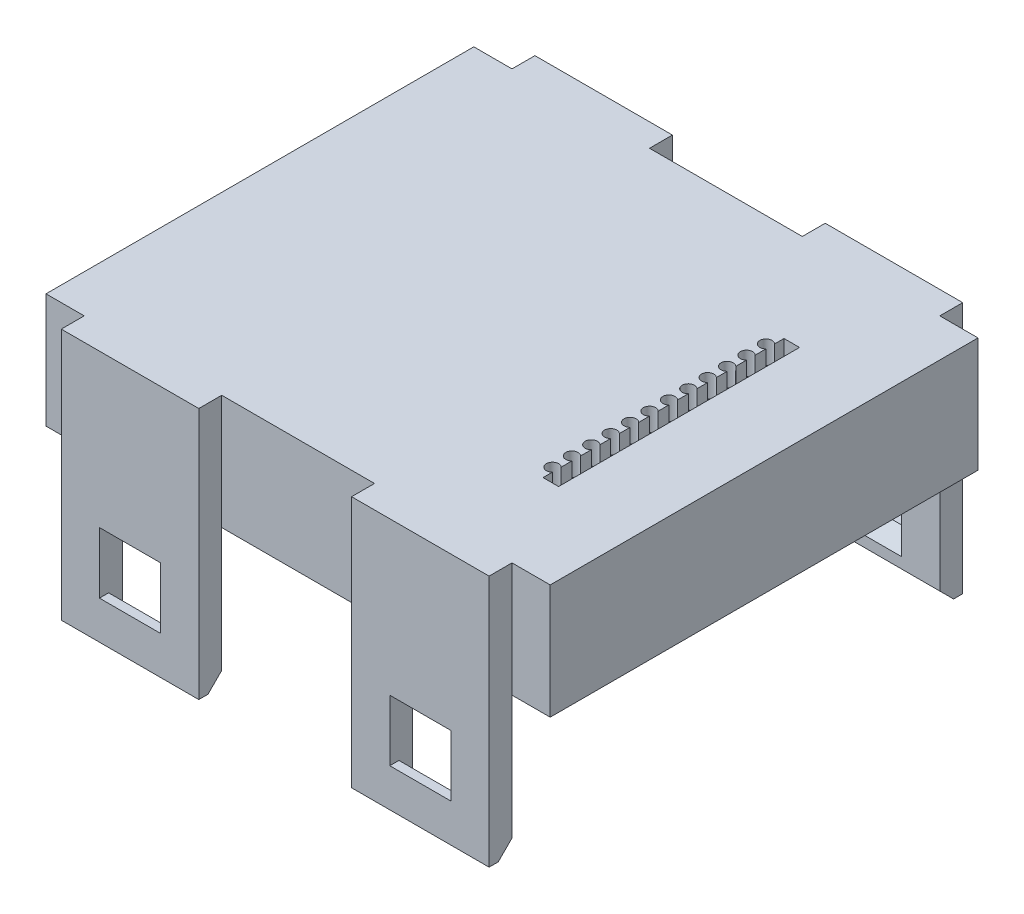
from build123d import *

# Parameters (mm, degrees)
SKETCH1_W           = 66
SKETCH1_H           = 56
BASE_DEPTH          = 3
WALL1_START         = -3
SKETCH4_W           = 66
SKETCH4_H           = 56
SKETCH4_W_2         = 58
SKETCH4_H_2         = 48
WALL1_DEPTH         = 12
WALL2_START         = -15
SKETCH8_W           = 62
SKETCH8_H           = 52
SKETCH8_W_2         = 58
SKETCH8_H_2         = 48
WALL2_DEPTH         = 2
BATTERYWALL_START   = -3
BATTERYWALL_DEPTH   = 8
BATTERYHOLDER_START = -11
SKETCH10_W          = 20
SKETCH10_H          = 48
BATTERYHOLDER_DEPTH = 2
BATTERYNOTCH_START  = -3
SKETCH15_W          = 1
SKETCH15_H          = 5
BATTERYNOTCH_DEPTH  = 1.2
BATTERYNOTCH2_R     = 1
CLIPS1_START        = 28
SKETCH11_W          = 18
SKETCH11_H          = 33
SKETCH11_W_2        = 8
SKETCH11_H_2        = 8
CLIPS1_DEPTH        = 3
CLIPS2_START        = -28
SKETCH11_2_W        = 18
SKETCH11_2_H        = 33
SKETCH11_2_W_2      = 8
SKETCH11_2_H_2      = 8
CLIPS2_DEPTH        = 3
CHAMFER3_SIZE       = 1.8
WIRESLOTS_START     = -3
SKETCH12_R          = 0.8
WIRESLOTS_DEPTH     = 60.026779311
WIRESLOTS2_START    = -3
SKETCH13_W          = 2.034314575
SKETCH13_H          = 31.54
WIRESLOTS2_DEPTH    = 60.026779311


with BuildPart() as part:
    # Sketch1 → Base (new body)
    with BuildSketch(Plane(origin=(0, 0, 0), x_dir=(1, 0, 0), z_dir=(0, 1, 0))):
        Rectangle(SKETCH1_W, SKETCH1_H)
    extrude(amount=-BASE_DEPTH)

    # Sketch4 → Wall1 (add)
    with BuildSketch(Plane(origin=(0, 0, 0), x_dir=(1, 0, 0), z_dir=(0, 1, 0)).offset(WALL1_START)):
        Rectangle(SKETCH4_W, SKETCH4_H)
        Rectangle(SKETCH4_W_2, SKETCH4_H_2, mode=Mode.SUBTRACT)
    extrude(amount=-WALL1_DEPTH)

    # Sketch8 → Wall2 (add)
    with BuildSketch(Plane(origin=(0, 0, 0), x_dir=(1, 0, 0), z_dir=(0, 1, 0)).offset(WALL2_START)):
        Rectangle(SKETCH8_W, SKETCH8_H)
        Rectangle(SKETCH8_W_2, SKETCH8_H_2, mode=Mode.SUBTRACT)
    extrude(amount=-WALL2_DEPTH)

    # Sketch9 → BatteryWall (add)
    with BuildSketch(Plane(origin=(0, 0, 0), x_dir=(1, 0, 0), z_dir=(0, 1, 0)).offset(BATTERYWALL_START)):
        Polygon((-23, 8.5), (13, 8.5), (13, 10.5), (-25, 10.5), (-25, -10.5), (13, -10.5), (13, -8.5), (-23, -8.5), align=None)
    extrude(amount=-BATTERYWALL_DEPTH)

    # Sketch10 → BatteryHolder (add)
    with BuildSketch(Plane(origin=(0, 0, 0), x_dir=(1, 0, 0), z_dir=(0, 1, 0)).offset(BATTERYHOLDER_START)):
        Rectangle(SKETCH10_W, SKETCH10_H)
    extrude(amount=-BATTERYHOLDER_DEPTH)

    # Sketch15 → BatteryNotch (add)
    with BuildSketch(Plane(origin=(0, 0, 0), x_dir=(1, 0, 0), z_dir=(0, 1, 0)).offset(BATTERYNOTCH_START)):
        with Locations((13.5, 0.010715453)):
            Rectangle(SKETCH15_W, SKETCH15_H)
    extrude(amount=-BATTERYNOTCH_DEPTH)

    # BatteryNotch2
    # the kernel refuses this fillet: 1 mm, written as the material it takes off along each edge
    with BuildSketch(Plane(origin=(14, -4.2, 4.989284547), x_dir=(0, 1, 0), z_dir=(0, 0, -1)), Plane(origin=(13, -4.2, -5.010715453), x_dir=(0, 1, 0), z_dir=(0, 0, 1))) as batterynotch2_piece_1:
        with BuildLine():
            CenterArc((BATTERYNOTCH2_R, -BATTERYNOTCH2_R), BATTERYNOTCH2_R, 90, 90)
            Line((0, -BATTERYNOTCH2_R), (0, 0))
            Line((0, 0), (BATTERYNOTCH2_R, 0))
        make_face()
    extrude(amount=10, mode=Mode.SUBTRACT)
    with BuildSketch(Plane(origin=(10.5, -4.2, 2.489284547), x_dir=(0, 1, 0), z_dir=(1, 0, 0)), Plane(origin=(16.5, -4.2, -2.510715453), x_dir=(0, 1, 0), z_dir=(-1, 0, 0))) as batterynotch2_piece_2:
        with BuildLine():
            CenterArc((BATTERYNOTCH2_R, -BATTERYNOTCH2_R), BATTERYNOTCH2_R, 90, 90)
            Line((0, -BATTERYNOTCH2_R), (0, 0))
            Line((0, 0), (BATTERYNOTCH2_R, 0))
        make_face()
    extrude(amount=6, mode=Mode.SUBTRACT)

    # Sketch11 → Clips1 (add)
    # profile 1 of 2: a face of its own
    with BuildSketch(Plane.XY.offset(CLIPS1_START)):
        with Locations((-19, -16.5)):
            Rectangle(SKETCH11_W, SKETCH11_H)
        with Locations((-19, -24)):
            Rectangle(SKETCH11_W_2, SKETCH11_H_2, mode=Mode.SUBTRACT)
    # profile 2 of 2: a face of its own
    with BuildSketch(Plane.XY.offset(CLIPS1_START)):
        with Locations((19, -16.5)):
            Rectangle(SKETCH11_W, SKETCH11_H)
        with Locations((19, -24)):
            Rectangle(SKETCH11_W_2, SKETCH11_H_2, mode=Mode.SUBTRACT)
    extrude(amount=CLIPS1_DEPTH)

    # Sketch11<2> → Clips2 (add)
    # profile 1 of 2: a face of its own
    with BuildSketch(Plane.XY.offset(CLIPS2_START)):
        with Locations((-19, -16.5)):
            Rectangle(SKETCH11_2_W, SKETCH11_2_H)
        with Locations((-19, -24)):
            Rectangle(SKETCH11_2_W_2, SKETCH11_2_H_2, mode=Mode.SUBTRACT)
    # profile 2 of 2: a face of its own
    with BuildSketch(Plane.XY.offset(CLIPS2_START)):
        with Locations((19, -16.5)):
            Rectangle(SKETCH11_2_W, SKETCH11_2_H)
        with Locations((19, -24)):
            Rectangle(SKETCH11_2_W_2, SKETCH11_2_H_2, mode=Mode.SUBTRACT)
    extrude(amount=-CLIPS2_DEPTH)

    # Chamfer3
    chamfer3_edges = [part.edges().sort_by_distance(p)[0] for p in [
        (-19, -33, 28),
        (-19, -28, 28),
        (19, -33, 28),
        (19, -28, 28),
        (-19, -28, -28),
        (-19, -33, -28),
        (19, -28, -28),
        (19, -33, -28),
    ]]
    chamfer(chamfer3_edges, length=CHAMFER3_SIZE)

    # Sketch12 → WireSlots (cut, through all)
    with BuildSketch(Plane(origin=(0, 0, 0), x_dir=(1, 0, 0), z_dir=(0, 1, 0)).offset(WIRESLOTS_START)):
        with Locations(Location((19.8, -14.5, 0), (0, 0, 90))):
            Circle(SKETCH12_R)
        with Locations(Location((19.8, -11.96, 0), (0, 0, 90))):
            Circle(SKETCH12_R)
        with Locations(Location((19.8, -9.42, 0), (0, 0, 90))):
            Circle(SKETCH12_R)
        with Locations(Location((19.8, -6.88, 0), (0, 0, 90))):
            Circle(SKETCH12_R)
        with Locations(Location((19.8, -4.34, 0), (0, 0, 90))):
            Circle(SKETCH12_R)
        with Locations(Location((19.8, -1.8, 0), (0, 0, 90))):
            Circle(SKETCH12_R)
        with Locations(Location((19.8, 0.74, 0), (0, 0, 90))):
            Circle(SKETCH12_R)
        with Locations(Location((19.8, 3.28, 0), (0, 0, 90))):
            Circle(SKETCH12_R)
        with Locations(Location((19.8, 5.82, 0), (0, 0, 90))):
            Circle(SKETCH12_R)
        with Locations(Location((19.8, 8.36, 0), (0, 0, 90))):
            Circle(SKETCH12_R)
        with Locations(Location((19.8, 10.9, 0), (0, 0, 90))):
            Circle(SKETCH12_R)
        with Locations(Location((19.8, 13.44, 0), (0, 0, 90))):
            Circle(SKETCH12_R)
    extrude(amount=WIRESLOTS_DEPTH, mode=Mode.SUBTRACT)

    # Sketch13 → WireSlots2 (cut, through all)
    with BuildSketch(Plane(origin=(0, 0, 0), x_dir=(1, 0, 0), z_dir=(0, 1, 0)).offset(WIRESLOTS2_START)):
        with Locations((21.382842713, -0.53)):
            Rectangle(SKETCH13_W, SKETCH13_H)
    extrude(amount=WIRESLOTS2_DEPTH, mode=Mode.SUBTRACT)


solid = part.part
